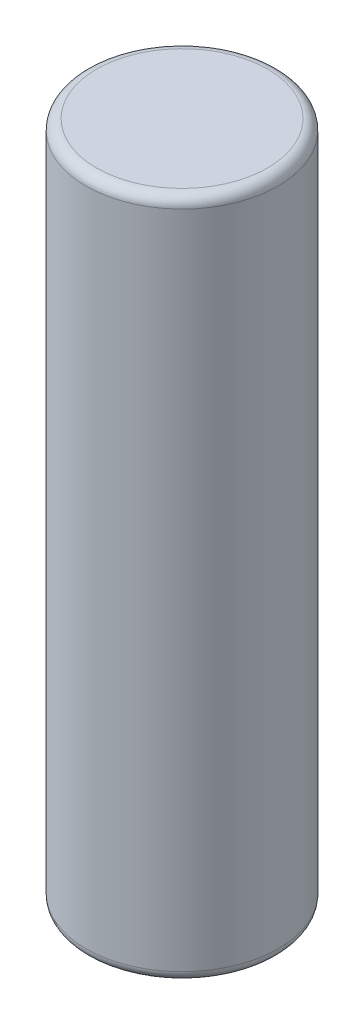
from build123d import *

# Parameters (mm, degrees)
SKETCH1_R           = 9.15
BOSS_EXTRUDE1_DEPTH = 64.9
FILLET1_R           = 1


with BuildPart() as part:
    # Sketch1 → Boss-Extrude1 (new body)
    with BuildSketch(Plane(origin=(0, 0, 0), x_dir=(1, 0, 0), z_dir=(0, 1, 0))):
        Circle(SKETCH1_R)
    extrude(amount=BOSS_EXTRUDE1_DEPTH)

    # Fillet1
    fillet1_edges = [part.edges().sort_by_distance(p)[0] for p in [
        (-9.15, 64.9, 0),
        (-9.15, 0, 0),
    ]]
    fillet(fillet1_edges, radius=FILLET1_R)


solid = part.part
